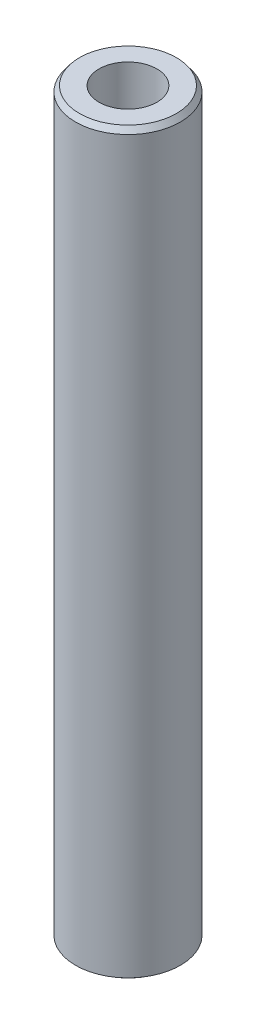
from build123d import *
from OCP.BRepFilletAPI import BRepFilletAPI_MakeChamfer

# Parameters (mm, degrees)
SKETCH1_R           = 42.5
BOSS_EXTRUDE1_DEPTH = 600
SKETCH2_R           = 23.473898826
CUT_EXTRUDE1_DEPTH  = 604.002902149
CHAMFER1_SIZE       = 4.389998724
CHAMFER1_SIZE2      = 3.190886446


with BuildPart() as part:
    # Sketch1 → Boss-Extrude1 (new body)
    with BuildSketch(Plane(origin=(0, 0, 0), x_dir=(1, 0, 0), z_dir=(0, 1, 0))):
        Circle(SKETCH1_R)
    extrude(amount=BOSS_EXTRUDE1_DEPTH)

    # Sketch2 → Cut-Extrude1 (cut, through all)
    with BuildSketch(Plane(origin=(0, 0, 0), x_dir=(1, 0, 0), z_dir=(0, 1, 0))):
        Circle(SKETCH2_R)
    extrude(amount=CUT_EXTRUDE1_DEPTH, mode=Mode.SUBTRACT)

    # Chamfer1: one chamfer whose edges measure the first distance from different faces: ONE call of the kernel's chamfer builder (chamfer() names one face for all edges)
    chamfer1_edges_1 = [part.edges().sort_by_distance(p)[0] for p in [
        (-42.5, 600, 0),
    ]]
    chamfer1_side_1 = [part.faces().sort_by_distance(p)[0] for p in [
        (-42.5, 300, 0),
    ]]
    chamfer1_edges_2 = [part.edges().sort_by_distance(p)[0] for p in [
        (-42.5, 0, 0),
    ]]
    chamfer1_side_2 = [part.faces().sort_by_distance(p)[0] for p in [
        (-41.297918472, 0, 0),
    ]]
    chamfer1 = BRepFilletAPI_MakeChamfer(part.part.solid().wrapped)
    for e in chamfer1_edges_1:
        chamfer1.Add(CHAMFER1_SIZE, CHAMFER1_SIZE2, e.wrapped, chamfer1_side_1[0].wrapped)  # the first distance lies on this face
    for e in chamfer1_edges_2:
        chamfer1.Add(CHAMFER1_SIZE, CHAMFER1_SIZE2, e.wrapped, chamfer1_side_2[0].wrapped)  # the first distance lies on this face
    add(Compound.cast(chamfer1.Shape()), mode=Mode.REPLACE)


solid = part.part
